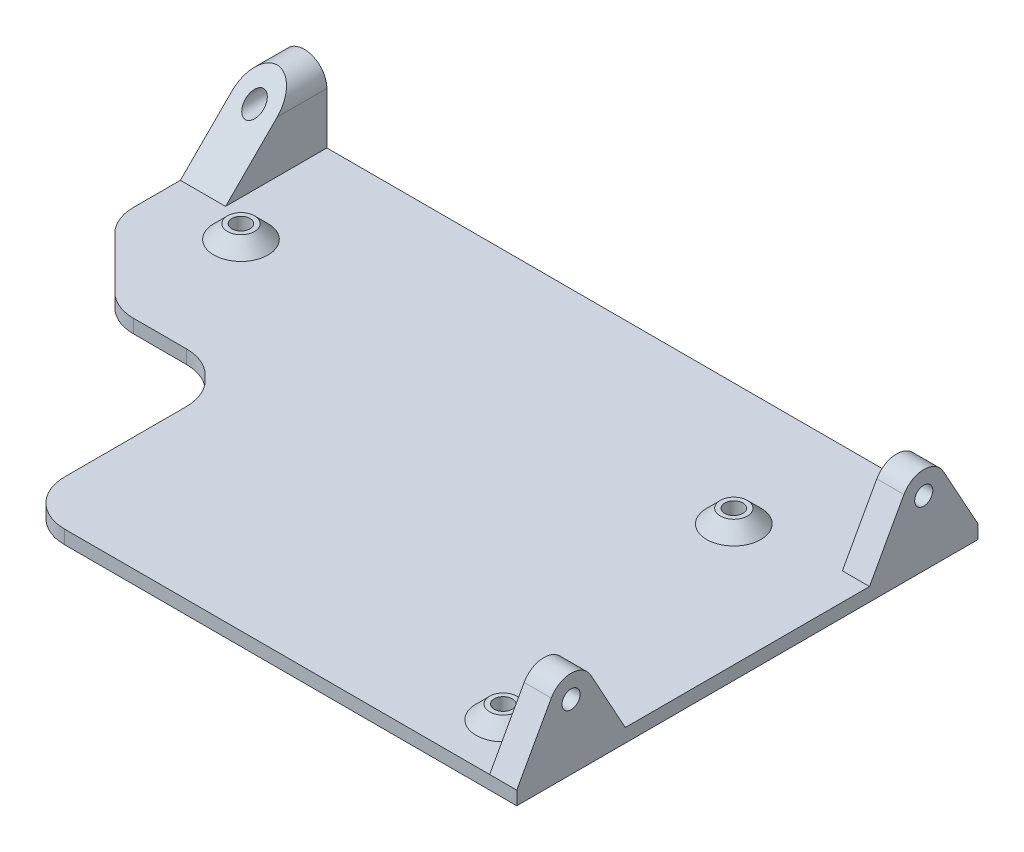
from build123d import *

# Parameters (mm, degrees)
SKETCH1_R                       = 2
BOSS_EXTRUDE1_DEPTH             = 3
SKETCH4_R                       = 3
SKETCH4_R_2                     = 2
BOSS_EXTRUDE2_DEPTH             = 3
CHAMFER1_SIZE                   = 3
BOSS_EXTRUDE3_DEPTH             = 4
BOSS_EXTRUDE4_DEPTH             = 20
CUT_EXTRUDE1_REACH              = 168.064
F_4_0MM_DOWEL_HOLE1_D           = 4
F_4_0MM_DOWEL_HOLE1_CSINK_D     = 4.05
F_4_0MM_DOWEL_HOLE1_CSINK_ANGLE = 90
SKETCH13_R                      = 2
BOSS_EXTRUDE5_DEPTH             = 6


with BuildPart() as part:
    # Sketch1 → Boss-Extrude1 (new body)
    with BuildSketch(Plane(origin=(0, 0, 0), x_dir=(1, 0, 0), z_dir=(0, 1, 0))):
        with BuildLine():
            ThreePointArc((-123.480593783, 26.275205138), (-122.719389108, 22.448370814), (-120.551661595, 19.204137326))
            Line((-120.551661595, 19.204137326), (-109.309020908, 7.961496639))
            ThreePointArc((-109.309020908, 7.961496639), (-106.064787419, 5.793769125), (-102.237953096, 5.032564451))
            Line((-102.237953096, 5.032564451), (-90.522224343, 5.032564451))
            ThreePointArc((-90.522224343, 5.032564451), (-86.69539002, 4.271359776), (-83.451156531, 2.103632262))
            Line((-83.451156531, 2.103632262), (-82.409525971, 1.062001702))
            ThreePointArc((-82.409525971, 1.062001702), (-80.241798458, -2.182231786), (-79.480593783, -6.00906611))
            Line((-79.480593783, -6.00906611), (-79.480593783, -32.967435549))
            ThreePointArc((-79.480593783, -32.967435549), (-76.551661595, -40.038503361), (-69.480593783, -42.967435549))
            Line((-69.480593783, -42.967435549), (30.519406217, -42.967435549))
            Line((30.519406217, -42.967435549), (30.519406217, 59.032564451))
            Line((30.519406217, 59.032564451), (-123.480593783, 59.032564451))
            Line((-123.480593783, 59.032564451), (-123.480593783, 26.275205138))
        make_face()
        with Locations((-105.480593783, 32.032564451)):
            Circle(SKETCH1_R, mode=Mode.SUBTRACT)
        with Locations((3.519406217, 32.032564451)):
            Circle(SKETCH1_R, mode=Mode.SUBTRACT)
        with Locations((15.519406217, -30.967435549)):
            Circle(SKETCH1_R, mode=Mode.SUBTRACT)
    extrude(amount=BOSS_EXTRUDE1_DEPTH)

    # Sketch4 → Boss-Extrude2 (add)
    # profile 1 of 3: a face of its own
    with BuildSketch(Plane(origin=(0, 3, 0), x_dir=(1, 0, 0), z_dir=(0, 1, 0))):
        with Locations(Location((-105.480593783, 32.032564451, 0), (0, 0, 90))):
            Circle(SKETCH4_R)
        with Locations(Location((-105.480593783, 32.032564451, 0), (0, 0, 270))):
            Circle(SKETCH4_R_2, mode=Mode.SUBTRACT)
    # profile 2 of 3: a face of its own
    with BuildSketch(Plane(origin=(0, 3, 0), x_dir=(1, 0, 0), z_dir=(0, 1, 0))):
        with Locations(Location((15.519406217, -30.967435549, 0), (0, 0, 90))):
            Circle(SKETCH4_R)
        with Locations(Location((15.519406217, -30.967435549, 0), (0, 0, 270))):
            Circle(SKETCH4_R_2, mode=Mode.SUBTRACT)
    # profile 3 of 3: a face of its own
    with BuildSketch(Plane(origin=(0, 3, 0), x_dir=(1, 0, 0), z_dir=(0, 1, 0))):
        with Locations(Location((3.519406217, 32.032564451, 0), (0, 0, 90))):
            Circle(SKETCH4_R)
        with Locations(Location((3.519406217, 32.032564451, 0), (0, 0, 270))):
            Circle(SKETCH4_R_2, mode=Mode.SUBTRACT)
    extrude(amount=BOSS_EXTRUDE2_DEPTH)

    # Chamfer1
    chamfer1_edges = [part.edges().sort_by_distance(p)[0] for p in [
        (-105.480593783, 3, -29.032564451),
        (15.519406217, 3, 33.967435549),
        (3.519406217, 3, -29.032564451),
    ]]
    chamfer(chamfer1_edges, length=CHAMFER1_SIZE - 0.0001)  # a hair under: the kernel refuses the full size

    # Sketch7 → Boss-Extrude3 (add)
    with BuildSketch(Plane(origin=(0, 0, -59.032564451), x_dir=(-1, 0, 0), z_dir=(0, 0, -1))):
        with BuildLine():
            Line((113.480593783, 14.4), (113.480593783, 3))
            Line((113.480593783, 3), (123.480593783, 3))
            Line((123.480593783, 3), (123.480593783, 14.4))
            ThreePointArc((123.480593783, 14.4), (118.480593783, 19.4), (113.480593783, 14.4))
        make_face()
    extrude(amount=-BOSS_EXTRUDE3_DEPTH)

    # Sketch9 → Boss-Extrude4 (add)
    with BuildSketch(Plane.XY.offset(-55.032564451)):
        with BuildLine():
            Line((-123.480593783, 3), (-113.480593783, 3))
            Line((-113.480593783, 3), (-113.480593783, 14.4))
            ThreePointArc((-113.480593783, 14.4), (-118.480593783, 19.4), (-123.480593783, 14.4))
            Line((-123.480593783, 14.4), (-123.480593783, 3))
        make_face()
    extrude(amount=BOSS_EXTRUDE4_DEPTH)

    # Sketch10 → Cut-Extrude1 (cut, up to next)
    with BuildSketch(Plane.ZY.offset(123.480593783), mode=Mode.PRIVATE) as cut_extrude1_sk1:
        Polygon((-53.032564451, 19.4), (-36.632564451, 3), (-35.032564451, 3), (-35.032564451, 19.4), align=None)
    cut_extrude1_tool1 = extrude(cut_extrude1_sk1.sketch, amount=-CUT_EXTRUDE1_REACH, mode=Mode.PRIVATE) & part.part
    add(cut_extrude1_tool1.solids().sort_by_distance((-123.480594, 13.487075, -41.076102))[0], mode=Mode.SUBTRACT)

    # Ø4.0mm Dowel Hole1 (through all)
    with Locations(Plane(origin=(0, 0, -59.032564451), x_dir=(-1, 0, 0), z_dir=(0, 0, -1))):
        with Locations((118.480593783, 14.4)):
            CounterSinkHole(F_4_0MM_DOWEL_HOLE1_D / 2, F_4_0MM_DOWEL_HOLE1_CSINK_D / 2, counter_sink_angle=F_4_0MM_DOWEL_HOLE1_CSINK_ANGLE)

    # Sketch13 → Boss-Extrude5 (add)
    # profile 1 of 2: a face of its own
    with BuildSketch(Plane(origin=(30.519406217, 0, 0), x_dir=(0, 0, -1), z_dir=(1, 0, 0))):
        with BuildLine():
            Line((-26.589524244, 16.815345234), (-18.967435549, 3))
            Line((-18.967435549, 3), (-42.967435549, 3))
            Line((-42.967435549, 3), (-35.345346855, 16.815345234))
            ThreePointArc((-35.345346855, 16.815345234), (-30.967435549, 19.4), (-26.589524244, 16.815345234))
        make_face()
        with Locations((-30.967435549, 14.4)):
            Circle(SKETCH13_R, mode=Mode.SUBTRACT)
    # profile 2 of 2: a face of its own
    with BuildSketch(Plane(origin=(30.519406217, 0, 0), x_dir=(0, 0, -1), z_dir=(1, 0, 0))):
        with BuildLine():
            Line((59.032564451, 3), (51.410475756, 16.815345234))
            ThreePointArc((51.410475756, 16.815345234), (47.032564451, 19.4), (42.654653145, 16.815345234))
            Line((42.654653145, 16.815345234), (35.032564451, 3))
            Line((35.032564451, 3), (59.032564451, 3))
        make_face()
        with Locations(Location((47.032564451, 14.4, 0), (0, 0, 180))):
            Circle(SKETCH13_R, mode=Mode.SUBTRACT)
    extrude(amount=-BOSS_EXTRUDE5_DEPTH)


solid = part.part
